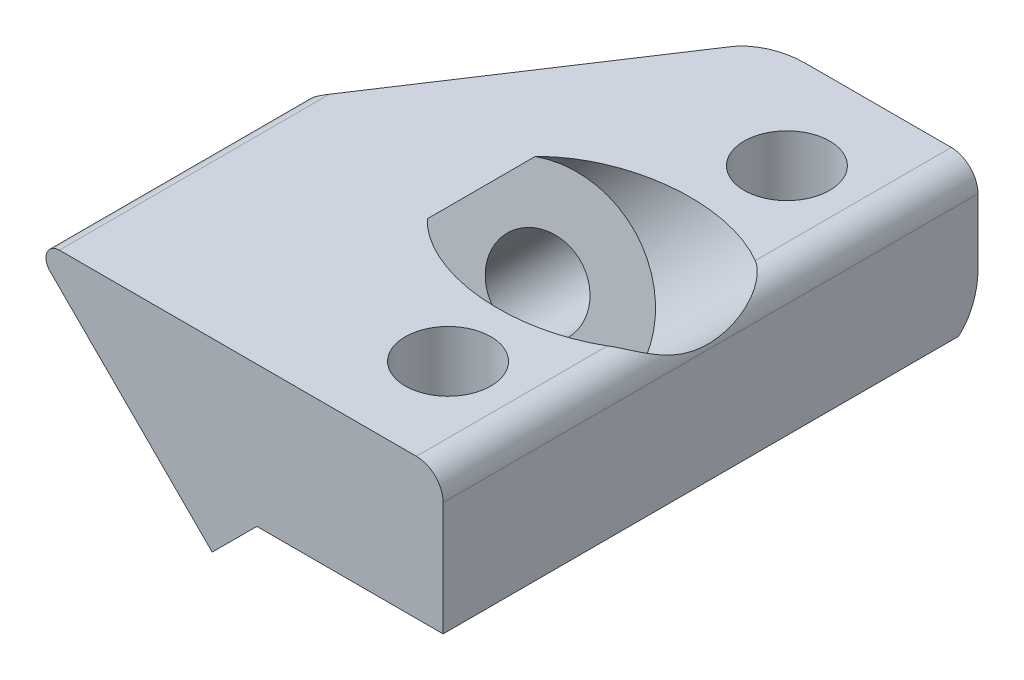
from build123d import *

# Parameters (mm, degrees)
BOSS_EXTRUDE1_DEPTH = 20
SKETCH6_R           = 1.6
CUT_EXTRUDE4_DEPTH  = 30.732137495
SKETCH7_R           = 2.7
CUT_EXTRUDE5_DEPTH  = 28.079952174
FILLET4_R           = 1
FILLET5_R           = 0.5
CUT_EXTRUDE6_DEPTH  = 10
CUT_EXTRUDE7_DEPTH  = 10
FILLET6_R           = 1.5
CUT_EXTRUDE8_DEPTH  = 26
SKETCH11_R          = 1.6
CUT_EXTRUDE9_DEPTH  = 26
SKETCH12_R          = 3.6
CUT_EXTRUDE10_DEPTH = 10
CUT_EXTRUDE13_DEPTH = 25
SKETCH14_R          = 4.5
CUT_EXTRUDE14_DEPTH = 10


# Read off the part's stored shape, not the designer's step: Mirror1
with BuildPart() as part:
    # Sketch1 → Boss-Extrude1 (new body)
    with BuildSketch(Plane.XY):
        Polygon((0, 0), (0, 15.556349186), (15.556349186, 0), align=None)
    extrude(amount=BOSS_EXTRUDE1_DEPTH)

    # Sketch6 → Cut-Extrude4 (cut, through all)
    with BuildSketch(Plane.ZY):
        with Locations((16.335044769, 3.48)):
            Circle(SKETCH6_R)
        with Locations((3.664955231, 3.48)):
            Circle(SKETCH6_R)
    extrude(amount=-CUT_EXTRUDE4_DEPTH, mode=Mode.SUBTRACT)

    # Sketch7 → Cut-Extrude5 (cut, through all)
    with BuildSketch(Plane.ZY.offset(-6)):
        with Locations((16.335044769, 3.48)):
            Circle(SKETCH7_R)
        with Locations((3.664955231, 3.48)):
            Circle(SKETCH7_R)
    extrude(amount=-CUT_EXTRUDE5_DEPTH, mode=Mode.SUBTRACT)

    # Fillet4
    fillet4_edges = [part.edges().sort_by_distance(p)[0] for p in [
        (0, 0, 10),
    ]]
    fillet(fillet4_edges, radius=FILLET4_R)

    # Fillet5
    # the kernel refuses this fillet: 0.5 mm, written as the material it takes off along each edge
    with BuildSketch(Plane(origin=(15.556349186, 0, -3.017766953), x_dir=(-0.7071067811865474, 0.7071067811865477, 0), z_dir=(0, 0, 1)), Plane(origin=(0, 15.556349186, -3.017766953), x_dir=(0, -1, 0), z_dir=(0, 0, 1))) as fillet5_piece_1:
        with BuildLine():
            CenterArc((FILLET5_R * 2.41421356237, FILLET5_R), FILLET5_R, 135, 135)
            Line((FILLET5_R * 1.70710678119, FILLET5_R * 1.70710678119), (0, 0))
            Line((0, 0), (FILLET5_R * 2.41421356237, 0))
        make_face()
    extrude(amount=26.035533906, mode=Mode.SUBTRACT)

    # Sketch8 → Cut-Extrude6 (cut)
    with BuildSketch(Plane(origin=(7.778174593, 7.778174593, 0), x_dir=(0, 0, -1), z_dir=(0.7071067811865477, 0.7071067811865475, 0))):
        Polygon((-20, -12.333051339), (0, -12.333051339), (0.012190886, -3.93058749), (-20, -3.93058749), align=None)
    extrude(amount=-CUT_EXTRUDE6_DEPTH, mode=Mode.SUBTRACT)

    # Sketch9 → Cut-Extrude7 (cut)
    with BuildSketch(Plane(origin=(7.778174593, 7.778174593, 0), x_dir=(0, 0, -1), z_dir=(0.7071067811865477, 0.7071067811865475, 0))):
        Polygon((-11.323221056, 10.808771842), (0, 5.528667149), (0, 10.808771842), align=None)
    extrude(amount=-CUT_EXTRUDE7_DEPTH, mode=Mode.SUBTRACT)

    # Fillet6
    fillet6_edges = [part.edges().sort_by_distance(p)[0] for p in [
        (8.058104899, 2.499414762, 0),
        (1.934408281, 9.753124344, 0),
    ]]
    fillet(fillet6_edges, radius=FILLET6_R)

    # Mirror1: part across plane


with BuildPart() as part_1:
    add(part.part)
    add(part.part.mirror(Plane(origin=(0, 15.556349186, 20), x_dir=(0, 0, 1), z_dir=(-0.7071067811865476, -0.7071067811865476, 0))))

    # Sketch10 → Cut-Extrude8 (cut)
    with BuildSketch(Plane.XY.offset(20)):
        Polygon((0.853553391, 14.702795796), (12.695020556, 2.86132863), (4.968641211, -4.865050714), (-9.455036557, 9.558627055), (-1.728657213, 17.285006399), align=None)
    extrude(amount=-CUT_EXTRUDE8_DEPTH, mode=Mode.SUBTRACT)

    # Sketch11 → Cut-Extrude9 (cut)
    with BuildSketch(Plane(origin=(7.778174593, 7.778174593, 0), x_dir=(0, 0, 1), z_dir=(-0.7071067811865477, -0.7071067811865475, 0))):
        with Locations(Location((10.089715554, 3.018295217, 0), (0, 0, 270))):
            Circle(SKETCH11_R)
    extrude(amount=-CUT_EXTRUDE9_DEPTH, mode=Mode.SUBTRACT)

    # Sketch12 → Cut-Extrude10 (cut)
    with BuildSketch(Plane(origin=(11.313708499, 11.313708499, 0), x_dir=(-0.7071067811865475, 0.7071067811865477, 0), z_dir=(-0.7071067811865477, -0.7071067811865475, 0))):
        with Locations((3.018295217, -10.089715554)):
            Circle(SKETCH12_R)
    extrude(amount=-CUT_EXTRUDE10_DEPTH, mode=Mode.SUBTRACT)

    # Sketch13 → Cut-Extrude13 (cut)
    with BuildSketch(Plane.XY.offset(20)):
        Polygon((15.86082052, 10.302130384), (8.59176281, 10.302130384), (6.922990806, 8.63335838), (10.557519661, 4.998829525), align=None)
    extrude(amount=-CUT_EXTRUDE13_DEPTH, mode=Mode.SUBTRACT)

    # Sketch14 → Cut-Extrude14 (cut)
    with BuildSketch(Plane.XZ.offset(-10.302130384)):
        with Locations((12.076349186, 16.335044769)):
            Circle(SKETCH14_R)
        with Locations((12.076349186, 3.664955231)):
            Circle(SKETCH14_R)
    extrude(amount=CUT_EXTRUDE14_DEPTH, mode=Mode.SUBTRACT)


solid = part_1.part
